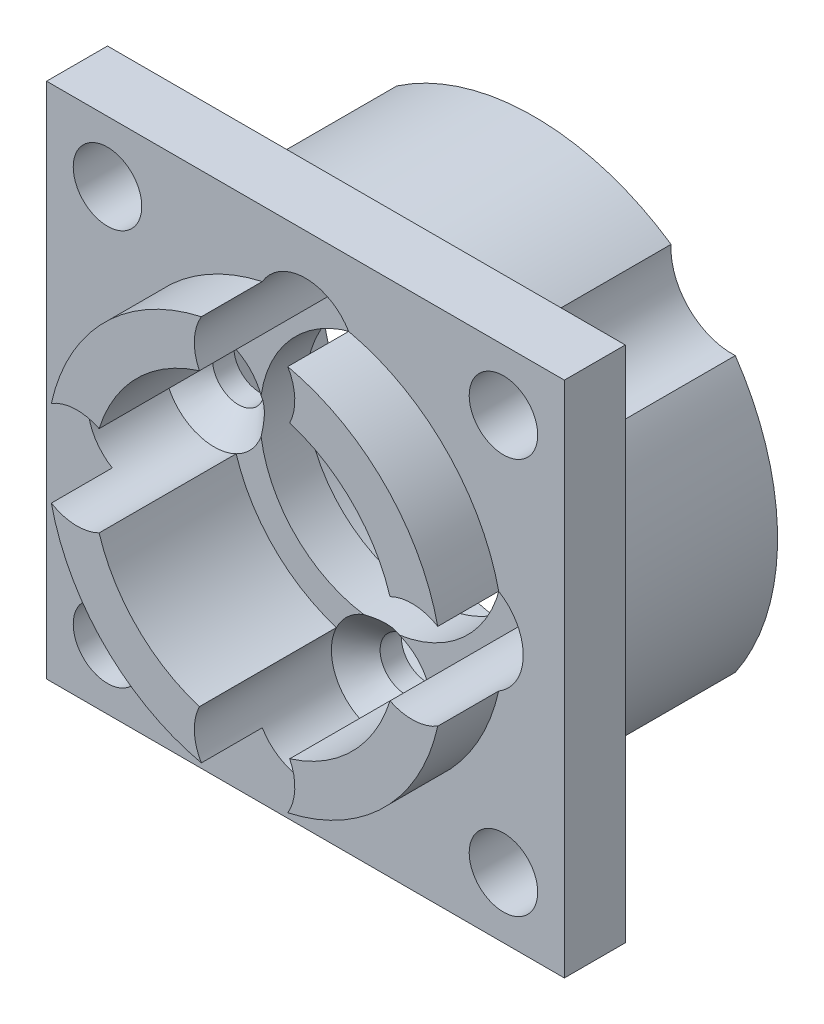
from build123d import *

# Parameters (mm, degrees)
HOLE_WIZARD_1_AT_2_COUNT  = 2
HOLE_WIZARD_1_AT_2_PITCH  = 15.556349186
HOLE_WIZARD_1_AT_3_COUNT  = 2
HOLE_WIZARD_1_AT_3_PITCH  = 22
HOLE_WIZARD_1_AT_4_COUNT  = 2
HOLE_WIZARD_1_AT_4_PITCH  = 15.556349186
SKETCH_4_W                = 34
SKETCH_4_H                = 34
SKETCH_4_R                = 16
EXTRUDE_1_DEPTH           = 4
HOLE_WIZARD_2_D           = 4.5
HOLE_WIZARD_2_CBORE_D     = 8
HOLE_WIZARD_2_CBORE_DEPTH = 11


with BuildPart() as part:
    # 草图1 → 旋转1 (revolve)
    with BuildSketch(Plane(origin=(0, 0, 0), x_dir=(0, 0, -1), z_dir=(1, 0, 0))):
        Polygon((0, 13), (0, 10), (9, 10), (9, 8), (12, 8), (12, 14), (19, 14), (19, 16), (4, 16), (4, 13), align=None)
    revolve(axis=Axis((0, 0, 0), (0, 0, -1)))

    # 草图2 → 打孔尺寸根据十字槽沉头木螺钉的类型1 (revolve, cut)
    with BuildSketch(Plane(origin=(0, 11, 0), x_dir=(0, -1, 0), z_dir=(1, 0, 0))):
        Polygon((0, 0), (0, 19), (1.7, 19), (1.7, 10.6), (3.3, 9), (3.3, 0), align=None)
    hole_wizard_1 = revolve(axis=Axis((0, 11, 6.35), (0, 0, -1)), mode=Mode.SUBTRACT)

    # 打孔尺寸根据十字槽沉头木螺钉的类型1 at 2: 打孔尺寸根据十字槽沉头木螺钉的类型1 ×2
    with Locations(*[Vector(0.7071067811865575, -0.7071067811865376, 0) * (i * HOLE_WIZARD_1_AT_2_PITCH) for i in range(1, HOLE_WIZARD_1_AT_2_COUNT)]):
        add(hole_wizard_1, mode=Mode.SUBTRACT)

    # 打孔尺寸根据十字槽沉头木螺钉的类型1 at 3: 打孔尺寸根据十字槽沉头木螺钉的类型1 ×2
    with Locations(*[(0, -i * HOLE_WIZARD_1_AT_3_PITCH, 0) for i in range(1, HOLE_WIZARD_1_AT_3_COUNT)]):
        add(hole_wizard_1, mode=Mode.SUBTRACT)

    # 打孔尺寸根据十字槽沉头木螺钉的类型1 at 4: 打孔尺寸根据十字槽沉头木螺钉的类型1 ×2
    with Locations(*[Vector(-0.7071067811865377, -0.7071067811865575, 0) * (i * HOLE_WIZARD_1_AT_4_PITCH) for i in range(1, HOLE_WIZARD_1_AT_4_COUNT)]):
        add(hole_wizard_1, mode=Mode.SUBTRACT)

    # 草图4 → 凸台-拉伸1 (add)
    with BuildSketch(Plane.XY.offset(-4)):
        Rectangle(SKETCH_4_W, SKETCH_4_H)
        Circle(SKETCH_4_R, mode=Mode.SUBTRACT)
    extrude(amount=-EXTRUDE_1_DEPTH)

    # 打孔尺寸根据内六角圆柱头螺钉的类型2 (through all)
    with Locations(Plane(origin=(0, 0, -19), x_dir=(-1, 0, 0), z_dir=(0, 0, -1))):
        with Locations((13, 13), (13, -13), (-13, -13), (-13, 13)):
            CounterBoreHole(HOLE_WIZARD_2_D / 2, HOLE_WIZARD_2_CBORE_D / 2, HOLE_WIZARD_2_CBORE_DEPTH)


solid = part.part
